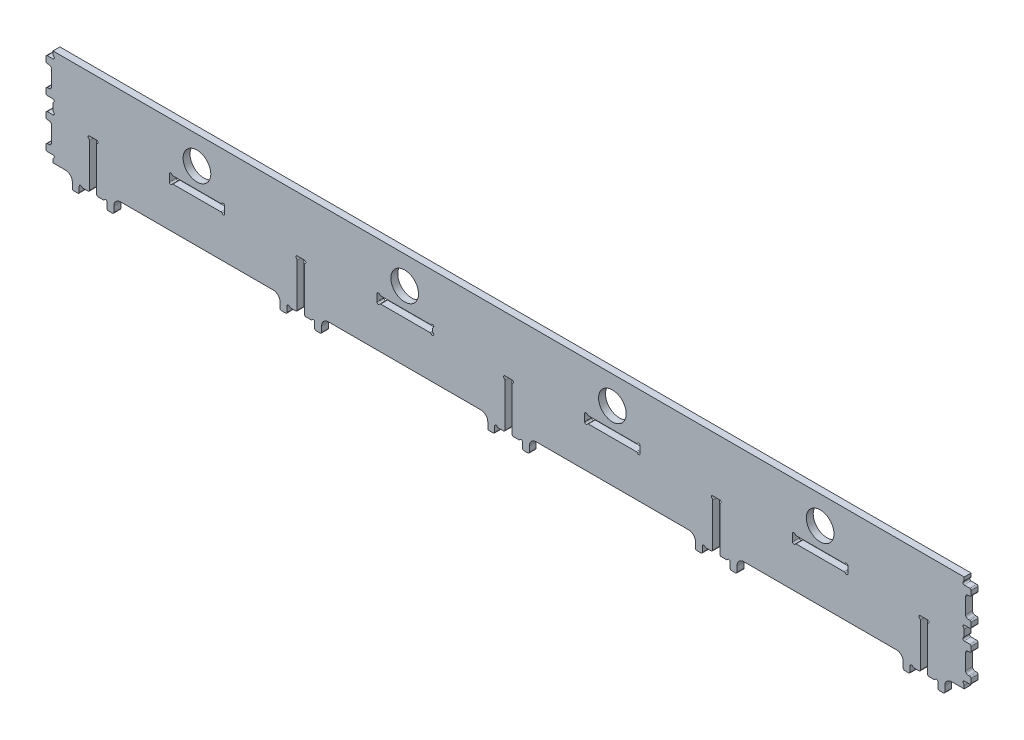
from build123d import *

# Parameters (mm, degrees)
SKETCH1_W               = 658
SKETCH1_H               = 80
BOSS_EXTRUDE1_DEPTH     = 2.5
CUT_EXTRUDE1_DEPTH      = 2.5
SKETCH3_W               = 40.2
SKETCH3_H               = 5.2
SKETCH3_W_2             = 40
SKETCH3_W_3             = 20
SKETCH3_H_2             = 10
CUT_EXTRUDE2_DEPTH      = 2.5
SKETCH4_W               = 5.2
SKETCH4_H               = 40
CUT_EXTRUDE3_DEPTH      = 339.595998204
LPATTERN1_COUNT         = 3
LPATTERN1_PITCH         = 150
MIRROR3_COPY_1_SKETCH_W = 5.2
MIRROR3_COPY_1_SKETCH_H = 40
MIRROR3_COPY_1_DEPTH    = 339.595998204
MIRROR3_COPY_2_SKETCH_W = 5.2
MIRROR3_COPY_2_SKETCH_H = 40
MIRROR3_COPY_2_DEPTH    = 339.595998204
MIRROR3_COPY_3_SKETCH_W = 5.2
MIRROR3_COPY_3_SKETCH_H = 40
MIRROR3_COPY_3_DEPTH    = 339.595998204
SKETCH5_R               = 1
CUT_EXTRUDE4_DEPTH      = 339.623684937
FILLET1_R               = 1
SKETCH6_R               = 1
CUT_EXTRUDE5_DEPTH      = 339.623684937
FILLET2_R               = 1
FILLET6_R               = 1
SKETCH11_R              = 1
CUT_EXTRUDE9_DEPTH      = 339.623684937
FILLET7_R               = 1
SKETCH12_W              = 5
SKETCH12_H              = 25
BOSS_EXTRUDE3_DEPTH     = 5
SKETCH13_W              = 5
SKETCH13_H              = 15
CUT_EXTRUDE10_DEPTH     = 4
FILLET8_R               = 2
SKETCH14_R              = 1
CUT_EXTRUDE11_DEPTH     = 344.483624064
FILLET9_R               = 1
SKETCH16_R              = 10
CUT_EXTRUDE13_DEPTH     = 344.483624064


with BuildPart() as part:
    # Sketch1 → Boss-Extrude1 (new, symmetric)
    with BuildSketch(Plane.XY):
        with Locations((0, 40)):
            Rectangle(SKETCH1_W, SKETCH1_H)
    extrude(amount=BOSS_EXTRUDE1_DEPTH, both=True)

    # Sketch2 → Cut-Extrude1 (cut, symmetric)
    with BuildSketch(Plane.XY):
        with BuildLine():
            Line((-15, 0), (-135, 0))
            Line((-135, 0), (-135, 5))
            ThreePointArc((-135, 5), (-133.535533906, 8.535533906), (-130, 10))
            Line((-130, 10), (-20, 10))
            ThreePointArc((-20, 10), (-16.464466094, 8.535533906), (-15, 5))
            Line((-15, 5), (-15, 0))
        make_face()
        with BuildLine():
            Line((-165, 0), (-285, 0))
            Line((-285, 0), (-285, 5))
            ThreePointArc((-285, 5), (-283.535533906, 8.535533906), (-280, 10))
            Line((-280, 10), (-170, 10))
            ThreePointArc((-170, 10), (-166.464466094, 8.535533906), (-165, 5))
            Line((-165, 5), (-165, 0))
        make_face()
        with BuildLine():
            Line((-315, 0), (-329, 0))
            Line((-329, 0), (-329, 10))
            Line((-329, 10), (-320, 10))
            ThreePointArc((-320, 10), (-316.464466094, 8.535533906), (-315, 5))
            Line((-315, 5), (-315, 0))
        make_face()
    cut_extrude1 = extrude(amount=CUT_EXTRUDE1_DEPTH, both=True, mode=Mode.SUBTRACT)

    # Mirror1: Cut-Extrude1 across plane
    add(cut_extrude1.mirror(Plane(origin=(0, 0, 0), x_dir=(0, 0, 1), z_dir=(1, 0, 0))), mode=Mode.SUBTRACT)

    # Sketch3 → Cut-Extrude2 (cut, symmetric)
    with BuildSketch(Plane.XY):
        with Locations((75, 42.6)):
            Rectangle(SKETCH3_W, SKETCH3_H)
        with Locations((225, 42.6)):
            Rectangle(SKETCH3_W_2, SKETCH3_H)
        with Locations((150, 0)):
            Rectangle(SKETCH3_W_3, SKETCH3_H_2)
        Rectangle(SKETCH3_W_3, SKETCH3_H_2)
        with Locations((300, 0)):
            Rectangle(SKETCH3_W_3, SKETCH3_H_2)
    cut_extrude2 = extrude(amount=CUT_EXTRUDE2_DEPTH, both=True, mode=Mode.SUBTRACT)

    # Mirror2: Cut-Extrude2 across plane
    add(cut_extrude2.mirror(Plane(origin=(0, 0, 0), x_dir=(0, 0, 1), z_dir=(1, 0, 0))), mode=Mode.SUBTRACT)

    # Sketch4 → Cut-Extrude3 (cut, symmetric)
    with BuildSketch(Plane.XY):
        with Locations((0, 20)):
            Rectangle(SKETCH4_W, SKETCH4_H)
    cut_extrude3 = extrude(amount=CUT_EXTRUDE3_DEPTH, both=True, mode=Mode.SUBTRACT)

    # LPattern1: Cut-Extrude3 ×3
    with Locations(*[(i * LPATTERN1_PITCH, 0, 0) for i in range(1, LPATTERN1_COUNT)]):
        add(cut_extrude3, mode=Mode.SUBTRACT)

    # Mirror3 copy 1 sketch → Mirror3 copy 1 (cut, symmetric)
    with BuildSketch(Plane(origin=(-150, 0, 0), x_dir=(-1, 0, 0), z_dir=(0, 0, 1))):
        with Locations((0, -20)):
            Rectangle(MIRROR3_COPY_1_SKETCH_W, MIRROR3_COPY_1_SKETCH_H)
    extrude(amount=MIRROR3_COPY_1_DEPTH, both=True, mode=Mode.SUBTRACT)

    # Mirror3 copy 2 sketch → Mirror3 copy 2 (cut, symmetric)
    with BuildSketch(Plane(origin=(-300, 0, 0), x_dir=(-1, 0, 0), z_dir=(0, 0, 1))):
        with Locations((0, -20)):
            Rectangle(MIRROR3_COPY_2_SKETCH_W, MIRROR3_COPY_2_SKETCH_H)
    extrude(amount=MIRROR3_COPY_2_DEPTH, both=True, mode=Mode.SUBTRACT)

    # Mirror3 copy 3 sketch → Mirror3 copy 3 (cut, symmetric)
    with BuildSketch(Plane(origin=(0, 0, 0), x_dir=(-1, 0, 0), z_dir=(0, 0, 1))):
        with Locations((0, -20)):
            Rectangle(MIRROR3_COPY_3_SKETCH_W, MIRROR3_COPY_3_SKETCH_H)
    extrude(amount=MIRROR3_COPY_3_DEPTH, both=True, mode=Mode.SUBTRACT)

    # Sketch5 → Cut-Extrude4 (cut, through all)
    with BuildSketch(Plane.XY.offset(2.5)):
        with Locations((-55, 40)):
            Circle(SKETCH5_R)
        with Locations((-55, 45)):
            Circle(SKETCH5_R)
        with Locations((-244, 45.2)):
            Circle(SKETCH5_R)
        with Locations((-244, 40)):
            Circle(SKETCH5_R)
        with Locations((-206, 45.2)):
            Circle(SKETCH5_R)
        with Locations((-206, 40)):
            Circle(SKETCH5_R)
        with Locations((-94, 45.2)):
            Circle(SKETCH5_R)
        with Locations((-94, 40)):
            Circle(SKETCH5_R)
        with Locations((56, 45.2)):
            Circle(SKETCH5_R)
        with Locations((56, 40)):
            Circle(SKETCH5_R)
        with Locations((94, 45.2)):
            Circle(SKETCH5_R)
        with Locations((94, 40)):
            Circle(SKETCH5_R)
        with Locations((206, 45.2)):
            Circle(SKETCH5_R)
        with Locations((206, 40)):
            Circle(SKETCH5_R)
        with Locations((244, 45.2)):
            Circle(SKETCH5_R)
        with Locations((244, 40)):
            Circle(SKETCH5_R)
    extrude(amount=-CUT_EXTRUDE4_DEPTH, mode=Mode.SUBTRACT)

    # Fillet1
    fillet1_edges = [part.edges().sort_by_distance(p)[0] for p in [
        (-54.9, 44.005012563, 0),
        (-55.979795897, 45.2, 0),
        (-56, 40, 0),
        (243, 40, 0),
        (207, 40, 0),
        (243, 45.2, 0),
        (207, 45.2, 0),
        (57, 45.2, 0),
        (93, 45.2, 0),
        (93, 40, 0),
        (57, 40, 0),
        (-93, 40, 0),
        (-93, 45.2, 0),
        (-207, 45.2, 0),
        (-207, 40, 0),
        (-243, 45.2, 0),
        (-243, 40, 0),
    ]]
    fillet(fillet1_edges, radius=FILLET1_R)

    # Sketch6 → Cut-Extrude5 (cut, through all)
    with BuildSketch(Plane.XY.offset(2.5)):
        with Locations((-302.6, 39)):
            Circle(SKETCH6_R)
        with Locations((-297.4, 39)):
            Circle(SKETCH6_R)
        with Locations((-152.6, 39)):
            Circle(SKETCH6_R)
        with Locations((-147.4, 39)):
            Circle(SKETCH6_R)
        with Locations((-2.6, 39)):
            Circle(SKETCH6_R)
        with Locations((2.6, 39)):
            Circle(SKETCH6_R)
        with Locations((147.4, 39)):
            Circle(SKETCH6_R)
        with Locations((152.6, 39)):
            Circle(SKETCH6_R)
        with Locations((297.4, 39)):
            Circle(SKETCH6_R)
        with Locations((302.6, 39)):
            Circle(SKETCH6_R)
    extrude(amount=-CUT_EXTRUDE5_DEPTH, mode=Mode.SUBTRACT)

    # Fillet2
    fillet2_edges = [part.edges().sort_by_distance(p)[0] for p in [
        (302.6, 38, 0),
        (297.4, 38, 0),
        (152.6, 38, 0),
        (147.4, 38, 0),
        (2.6, 38, 0),
        (-2.6, 38, 0),
        (-147.4, 38, 0),
        (-152.6, 38, 0),
        (-297.4, 38, 0),
        (-302.6, 38, 0),
    ]]
    fillet(fillet2_edges, radius=FILLET2_R)

    # Fillet6
    fillet6_edges = [part.edges().sort_by_distance(p)[0] for p in [
        (315, 0, 0),
        (302.6, 5, 0),
        (297.4, 5, 0),
        (310, 0, 0),
        (290, 0, 0),
        (285, 0, 0),
        (165, 0, 0),
        (160, 0, 0),
        (152.6, 5, 0),
        (147.4, 5, 0),
        (140, 0, 0),
        (135, 0, 0),
        (-147.4, 5, 0),
        (15, 0, 0),
        (10, 0, 0),
        (2.6, 5, 0),
        (-2.6, 5, 0),
        (-10, 0, 0),
        (-15, 0, 0),
        (-135, 0, 0),
        (-140, 0, 0),
        (-152.6, 5, 0),
        (-165, 0, 0),
        (-160, 0, 0),
        (-285, 0, 0),
        (-290, 0, 0),
        (-297.4, 5, 0),
        (-302.6, 5, 0),
        (-310, 0, 0),
        (-315, 0, 0),
    ]]
    fillet(fillet6_edges, radius=FILLET6_R)

    # Sketch11 → Cut-Extrude9 (cut, through all)
    with BuildSketch(Plane.XY.offset(2.5)):
        with Locations((-309, 5)):
            Circle(SKETCH11_R)
        with Locations((-291, 5)):
            Circle(SKETCH11_R)
        with Locations((-159, 5)):
            Circle(SKETCH11_R)
        with Locations((-141, 5)):
            Circle(SKETCH11_R)
        with Locations((-9, 5)):
            Circle(SKETCH11_R)
        with Locations((9, 5)):
            Circle(SKETCH11_R)
        with Locations((141, 5)):
            Circle(SKETCH11_R)
        with Locations((159, 5)):
            Circle(SKETCH11_R)
        with Locations((291, 5)):
            Circle(SKETCH11_R)
        with Locations((309, 5)):
            Circle(SKETCH11_R)
    extrude(amount=-CUT_EXTRUDE9_DEPTH, mode=Mode.SUBTRACT)

    # Fillet7
    fillet7_edges = [part.edges().sort_by_distance(p)[0] for p in [
        (308, 5, 0),
        (292, 5, 0),
        (158, 5, 0),
        (142, 5, 0),
        (8, 5, 0),
        (-8, 5, 0),
        (-142, 5, 0),
        (-158, 5, 0),
        (-292, 5, 0),
        (-308, 5, 0),
    ]]
    fillet(fillet7_edges, radius=FILLET7_R)

    # Sketch12 → Boss-Extrude3 (add)
    with BuildSketch(Plane.ZY.offset(329)):
        with Locations((0, 62.5)):
            Rectangle(SKETCH12_W, SKETCH12_H)
        with Locations((0, 27.5)):
            Rectangle(SKETCH12_W, SKETCH12_H)
    boss_extrude3 = extrude(amount=BOSS_EXTRUDE3_DEPTH)

    # Sketch13 → Cut-Extrude10 (cut)
    with BuildSketch(Plane.ZY.offset(334)):
        with Locations((0, 62.5)):
            Rectangle(SKETCH13_W, SKETCH13_H)
        with Locations((0, 27.5)):
            Rectangle(SKETCH13_W, SKETCH13_H)
    cut_extrude10 = extrude(amount=-CUT_EXTRUDE10_DEPTH, mode=Mode.SUBTRACT)

    # Mirror5: Boss-Extrude3, Cut-Extrude10 across plane
    add(boss_extrude3.mirror(Plane(origin=(0, 0, 0), x_dir=(0, 0, 1), z_dir=(1, 0, 0))))
    add(cut_extrude10.mirror(Plane(origin=(0, 0, 0), x_dir=(0, 0, 1), z_dir=(1, 0, 0))), mode=Mode.SUBTRACT)

    # Fillet8
    fillet8_edges = [part.edges().sort_by_distance(p)[0] for p in [
        (330, 20, 0),
        (330, 35, 0),
        (330, 55, 0),
        (330, 70, 0),
        (-330, 20, 0),
        (-330, 35, 0),
        (-330, 70, 0),
        (-330, 55, 0),
    ]]
    fillet(fillet8_edges, radius=FILLET8_R)

    # Sketch14 → Cut-Extrude11 (cut, through all)
    with BuildSketch(Plane.XY.offset(2.5)):
        with Locations((-329, 76)):
            Circle(SKETCH14_R)
        with Locations((-329, 49)):
            Circle(SKETCH14_R)
        with Locations((-329, 41)):
            Circle(SKETCH14_R)
        with Locations((-329, 14)):
            Circle(SKETCH14_R)
        with Locations((329, 14)):
            Circle(SKETCH14_R)
        with Locations((329, 41)):
            Circle(SKETCH14_R)
        with Locations((329, 49)):
            Circle(SKETCH14_R)
        with Locations((329, 76)):
            Circle(SKETCH14_R)
    extrude(amount=-CUT_EXTRUDE11_DEPTH, mode=Mode.SUBTRACT)

    # Fillet9
    fillet9_edges = [part.edges().sort_by_distance(p)[0] for p in [
        (-329, 13, 0),
        (-334, 15, 0),
        (-334, 20, 0),
        (-334, 35, 0),
        (-334, 40, 0),
        (-329, 42, 0),
        (-329, 48, 0),
        (-334, 50, 0),
        (-334, 55, 0),
        (-334, 70, 0),
        (-334, 75, 0),
        (-329, 77, 0),
        (329, 77, 0),
        (334, 75, 0),
        (334, 70, 0),
        (334, 55, 0),
        (334, 50, 0),
        (329, 48, 0),
        (329, 42, 0),
        (334, 40, 0),
        (334, 35, 0),
        (334, 20, 0),
        (334, 15, 0),
        (329, 13, 0),
    ]]
    fillet(fillet9_edges, radius=FILLET9_R)

    # Sketch16 → Cut-Extrude13 (cut, through all)
    with BuildSketch(Plane.XY.offset(2.5)):
        with Locations((-75, 60)):
            Circle(SKETCH16_R)
        with Locations((-225, 60)):
            Circle(SKETCH16_R)
        with Locations((225, 60)):
            Circle(SKETCH16_R)
        with Locations((75, 60)):
            Circle(SKETCH16_R)
    extrude(amount=-CUT_EXTRUDE13_DEPTH, mode=Mode.SUBTRACT)


solid = part.part
